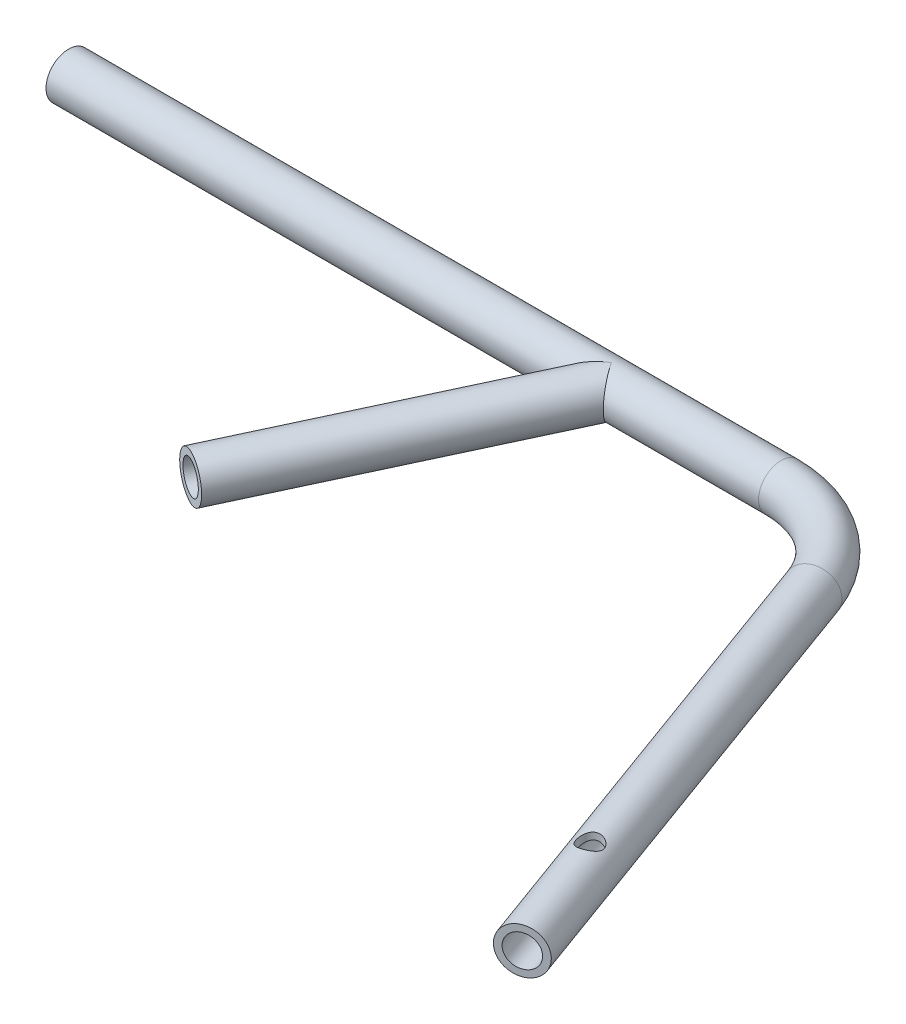
from build123d import *

# Parameters (mm, degrees)
SWEEP_THIN2_PROFILE_R   = 10
SWEEP_THIN2_PROFILE_R_2 = 7
CUT_EXTRUDE1_DEPTH      = 500.751926697
CUT_EXTRUDE1_DEPTH_BACK = 500.751926697
SKETCH22_R              = 5
SWEEP_THIN3_START       = -9.711313495
SWEEP_THIN3_OUTLINE_R   = 10
SWEEP_THIN3_OUTLINE_R_2 = 7
SWEEP_THIN3_DEPTH       = 140


with BuildPart() as part:
    # Sweep-Thin2: sweep along a path in Sketch1
    with BuildLine(Plane(origin=(0, 0, 0), x_dir=(1, 0, 0), z_dir=(0, 1, 0))) as sweep_thin2_path:
        Line((0, 0), (-73.530781703, 202.024162363))
        ThreePointArc((-73.530781703, 202.024162363), (-91.836590924, 225.880757411), (-120.515412742, 234.923155196))
        Line((-120.515412742, 234.923155196), (-435.505035831, 234.923155196))
    # Sweep-Thin2 profile (on start of the path) → Sweep-Thin2 (sweep)
    with BuildSketch(Plane(origin=(0, 0, 0), x_dir=(-0.9396926207859093, 0, 0.3420201433256662), z_dir=(-0.3420201433256662, 0, -0.9396926207859093))):
        Circle(SWEEP_THIN2_PROFILE_R)
        Circle(SWEEP_THIN2_PROFILE_R_2, mode=Mode.SUBTRACT)
    sweep(path=sweep_thin2_path.line)

    # Sketch22 → Cut-Extrude1 (cut, two sides: drawn at the far end of the back side and taken through both)
    with BuildSketch(Plane(origin=(0, 0, 0), x_dir=(1, 0, 0), z_dir=(0, 1, 0)).offset(-CUT_EXTRUDE1_DEPTH_BACK)):
        with Locations(Location((-17.101007166, 46.984631039, 0), (0, 0, 270))):
            Circle(SKETCH22_R)
    extrude(amount=CUT_EXTRUDE1_DEPTH + CUT_EXTRUDE1_DEPTH_BACK, mode=Mode.SUBTRACT)

    # Sweep-Thin3: read off the stored shape, not the designer's step
    # Sweep-Thin3 outline → Sweep-Thin3 (add)
    with BuildSketch(Plane(origin=(0, 0, 0), x_dir=(0.906307787036651, 0, 0.42261826174069705), z_dir=(0.42261826174069705, 0, -0.9063077870366512)).offset(SWEEP_THIN3_START)):
        with Locations((-276.470551871, 0)):
            Circle(SWEEP_THIN3_OUTLINE_R)
        with Locations((-276.470551871, 0)):
            Circle(SWEEP_THIN3_OUTLINE_R_2, mode=Mode.SUBTRACT)
    extrude(amount=SWEEP_THIN3_DEPTH)


solid = part.part
